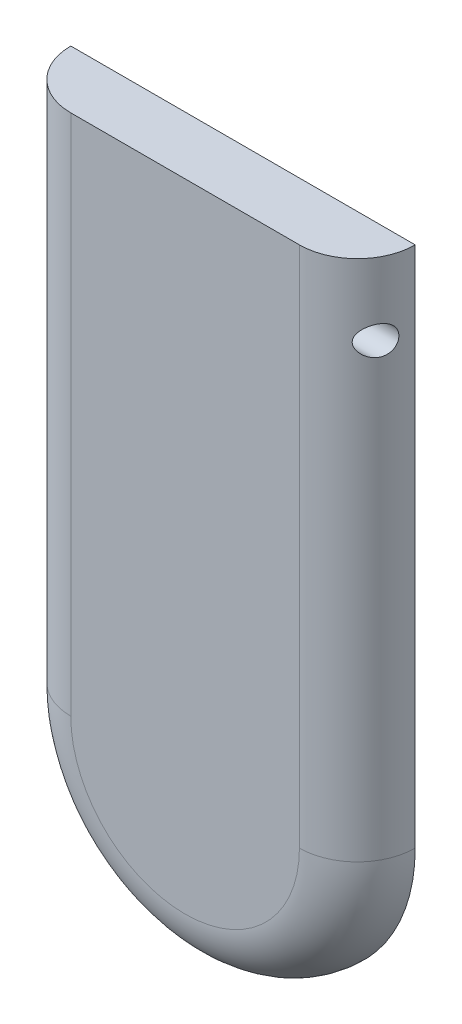
from build123d import *

# Parameters (mm, degrees)
EXTRUDE_1_DEPTH     = 10
SKETCH_9_R          = 2.5
CUT_EXTRUDE_1_DEPTH = 59.5
FILLET_3_R          = 10


with BuildPart() as part:
    # Эскиз1 → Бобышка-Вытянуть1 (new body)
    with BuildSketch(Plane.XY):
        with BuildLine():
            Line((0, 0), (59.5, 0))
            Line((59.5, 0), (59.5, -90.25))
            ThreePointArc((59.5, -90.25), (29.75, -120), (0, -90.25))
            Line((0, -90.25), (0, 0))
        make_face()
    extrude(amount=EXTRUDE_1_DEPTH)

    # Эскиз9 → Вырез-Вытянуть1 (cut)
    with BuildSketch(Plane(origin=(59.5, 0, 0), x_dir=(0, 0, -1), z_dir=(1, 0, 0))):
        with Locations(Location((-5, -12.5, 0), (0, 0, 90))):
            Circle(SKETCH_9_R)
    extrude(amount=-CUT_EXTRUDE_1_DEPTH, mode=Mode.SUBTRACT)

    # Скругление3
    # the kernel refuses this fillet: 10 mm, written as the material it takes off along each edge
    with BuildSketch(Plane(origin=(0, -90.25, 10), x_dir=(0, 0, -1), z_dir=(0, 1, 0)), Plane(origin=(59.5, 25, 10), x_dir=(0, 0, -1), z_dir=(0, -1, 0))) as fillet_3_piece_1:
        with BuildLine():
            CenterArc((FILLET_3_R, -FILLET_3_R), FILLET_3_R, 90, 90)
            Line((0, -FILLET_3_R), (0, 0))
            Line((0, 0), (FILLET_3_R, 0))
        make_face()
    extrude(amount=115.25, mode=Mode.SUBTRACT)
    with BuildSketch(Plane(origin=(29.75, -90.25, 10), x_dir=(1, 0, 0), z_dir=(0, 1, 0))) as fillet_3_piece_2:
        with BuildLine():
            CenterArc((29.75 - FILLET_3_R, FILLET_3_R), FILLET_3_R, 270, 90)
            Line((29.75 - FILLET_3_R, 0), (29.75, 0))
            Line((29.75, 0), (29.75, FILLET_3_R))
        make_face()
    revolve(axis=Axis((29.75, -90.25, 10), (0, 0, -1)), revolution_arc=180, mode=Mode.SUBTRACT)


solid = part.part
